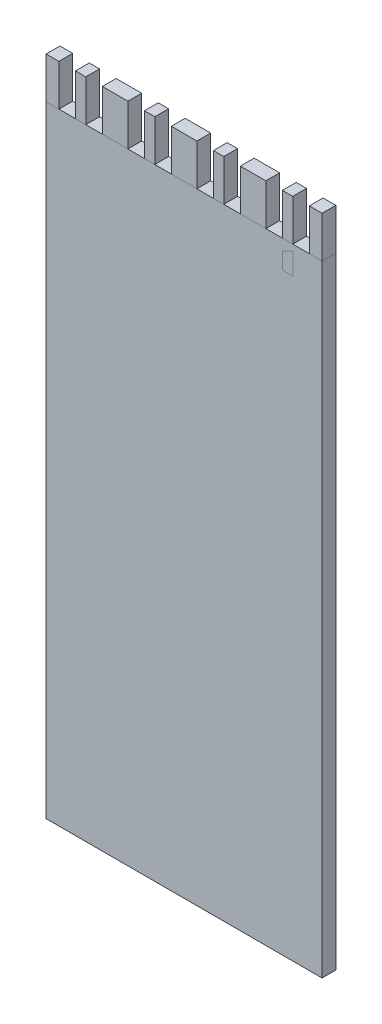
from build123d import *

# Parameters (mm, degrees)
SKETCH3_W             = 3.705882353
SKETCH3_H             = 4
BOSS_EXTRUDE2_DEPTH   = 12
SKETCH3_W_2           = 3
BOSS_EXTRUDE2_2_DEPTH = 12
SKETCH3_W_3           = 7.411764706
BOSS_EXTRUDE2_3_DEPTH = 12
BOSS_EXTRUDE2_4_DEPTH = 12
BOSS_EXTRUDE2_5_DEPTH = 12
BOSS_EXTRUDE2_6_DEPTH = 12
BOSS_EXTRUDE2_7_DEPTH = 12
BOSS_EXTRUDE2_8_DEPTH = 12
BOSS_EXTRUDE2_9_DEPTH = 12
SKETCH3_6_W           = 3
SKETCH3_6_H           = 4
BOSS_EXTRUDE4_DEPTH   = 16
BOSS_EXTRUDE5_START   = -12
SKETCH3_7_W           = 3
SKETCH3_7_H           = 4
BOSS_EXTRUDE5_DEPTH   = 4
SKETCH4_W             = 80
SKETCH4_H             = 180
BOSS_EXTRUDE6_DEPTH   = 4


with BuildPart() as part:
    # Sketch3 → Boss-Extrude2 (new body)
    with BuildSketch(Plane(origin=(0, 0, 0), x_dir=(1, 0, 0), z_dir=(0, 1, 0))):
        with Locations((-12.511786974, -220.31766228)):
            Rectangle(SKETCH3_W, SKETCH3_H)
    extrude(amount=BOSS_EXTRUDE2_DEPTH)


with BuildPart() as body_2:
    # Sketch3 → Boss-Extrude2 2 (new body)
    with BuildSketch(Plane(origin=(0, 0, 0), x_dir=(1, 0, 0), z_dir=(0, 1, 0))):
        with Locations((-4.36472815, -220.31766228)):
            Rectangle(SKETCH3_W_2, SKETCH3_H)
    extrude(amount=BOSS_EXTRUDE2_2_DEPTH)



with BuildPart() as body_3:
    # Sketch3 → Boss-Extrude2 3 (new body)
    with BuildSketch(Plane(origin=(0, 0, 0), x_dir=(1, 0, 0), z_dir=(0, 1, 0))):
        with Locations((5.63527185, -220.31766228)):
            Rectangle(SKETCH3_W_3, SKETCH3_H)
    extrude(amount=BOSS_EXTRUDE2_3_DEPTH)


with BuildPart() as body_4:
    # Sketch3 → Boss-Extrude2 4 (new body)
    with BuildSketch(Plane(origin=(0, 0, 0), x_dir=(1, 0, 0), z_dir=(0, 1, 0))):
        with Locations((15.63527185, -220.31766228)):
            Rectangle(SKETCH3_W_2, SKETCH3_H)
    extrude(amount=BOSS_EXTRUDE2_4_DEPTH)


with BuildPart() as body_5:
    # Sketch3 → Boss-Extrude2 5 (new body)
    with BuildSketch(Plane(origin=(0, 0, 0), x_dir=(1, 0, 0), z_dir=(0, 1, 0))):
        with Locations((25.63527185, -220.31766228)):
            Rectangle(SKETCH3_W_3, SKETCH3_H)
    extrude(amount=BOSS_EXTRUDE2_5_DEPTH)


with BuildPart() as body_6:
    # Sketch3 → Boss-Extrude2 6 (new body)
    with BuildSketch(Plane(origin=(0, 0, 0), x_dir=(1, 0, 0), z_dir=(0, 1, 0))):
        with Locations((35.63527185, -220.31766228)):
            Rectangle(SKETCH3_W_2, SKETCH3_H)
    extrude(amount=BOSS_EXTRUDE2_6_DEPTH)


with BuildPart() as body_7:
    # Sketch3 → Boss-Extrude2 7 (new body)
    with BuildSketch(Plane(origin=(0, 0, 0), x_dir=(1, 0, 0), z_dir=(0, 1, 0))):
        with Locations((45.63527185, -220.31766228)):
            Rectangle(SKETCH3_W_3, SKETCH3_H)
    extrude(amount=BOSS_EXTRUDE2_7_DEPTH)


with BuildPart() as body_8:
    # Sketch3 → Boss-Extrude2 8 (new body)
    with BuildSketch(Plane(origin=(0, 0, 0), x_dir=(1, 0, 0), z_dir=(0, 1, 0))):
        with Locations((55.63527185, -220.31766228)):
            Rectangle(SKETCH3_W_2, SKETCH3_H)
    extrude(amount=BOSS_EXTRUDE2_8_DEPTH)


with BuildPart() as body_9:
    # Sketch3 → Boss-Extrude2 9 (new body)
    with BuildSketch(Plane(origin=(0, 0, 0), x_dir=(1, 0, 0), z_dir=(0, 1, 0))):
        with Locations((63.782330674, -220.31766228)):
            Rectangle(SKETCH3_W, SKETCH3_H)
    extrude(amount=BOSS_EXTRUDE2_9_DEPTH)


with BuildPart() as body_2_1:
    add(body_2.part)

    add(body_4.part)  # Boss-Extrude4 merges body 4

    add(body_6.part)  # Boss-Extrude4 merges body 6

    add(body_8.part)  # Boss-Extrude4 merges body 8
    # Sketch3<6> → Boss-Extrude4 (add)
    with BuildSketch(Plane(origin=(0, 0, 0), x_dir=(1, 0, 0), z_dir=(0, 1, 0))):
        with Locations((-4.36472815, -220.31766228)):
            Rectangle(SKETCH3_6_W, SKETCH3_6_H)
        with Locations((15.63527185, -220.31766228)):
            Rectangle(SKETCH3_6_W, SKETCH3_6_H)
        with Locations((35.63527185, -220.31766228)):
            Rectangle(SKETCH3_6_W, SKETCH3_6_H)
        with Locations((55.63527185, -220.31766228)):
            Rectangle(SKETCH3_6_W, SKETCH3_6_H)
    extrude(amount=-BOSS_EXTRUDE4_DEPTH)

    # Sketch3<7> → Boss-Extrude5 (add)
    with BuildSketch(Plane(origin=(0, 0, 0), x_dir=(1, 0, 0), z_dir=(0, 1, 0)).offset(BOSS_EXTRUDE5_START)):
        with Locations((-7.36472815, -220.31766228)):
            Rectangle(SKETCH3_7_W, SKETCH3_7_H)
        with Locations((-1.36472815, -220.31766228)):
            Rectangle(SKETCH3_7_W, SKETCH3_7_H)
        with Locations((12.63527185, -220.31766228)):
            Rectangle(SKETCH3_7_W, SKETCH3_7_H)
        with Locations((18.63527185, -220.31766228)):
            Rectangle(SKETCH3_7_W, SKETCH3_7_H)
        with Locations((32.63527185, -220.31766228)):
            Rectangle(SKETCH3_7_W, SKETCH3_7_H)
        with Locations((38.63527185, -220.31766228)):
            Rectangle(SKETCH3_7_W, SKETCH3_7_H)
        with Locations((52.63527185, -220.31766228)):
            Rectangle(SKETCH3_7_W, SKETCH3_7_H)
        with Locations((58.63527185, -220.31766228)):
            Rectangle(SKETCH3_7_W, SKETCH3_7_H)
    extrude(amount=BOSS_EXTRUDE5_DEPTH)


with BuildPart() as body_7_2:
    # Sketch4 → Boss-Extrude6 (new body)
    with BuildSketch(Plane.XY):
        with Locations((10.2897637, -144.973534825)):
            Rectangle(SKETCH4_W, SKETCH4_H)
    extrude(amount=BOSS_EXTRUDE6_DEPTH)


with BuildPart() as body_7_2_1:
    # Body-Move/Copy1: read off the stored shape, not the designer's step
    # Body-Move/Copy1: moved
    add(body_7_2.part.moved(Location((15.3455082, 54.9735348, 218.3176623))))


solid = Compound([part.part, body_3.part, body_5.part, body_7.part, body_9.part, body_2_1.part, body_7_2_1.part])
